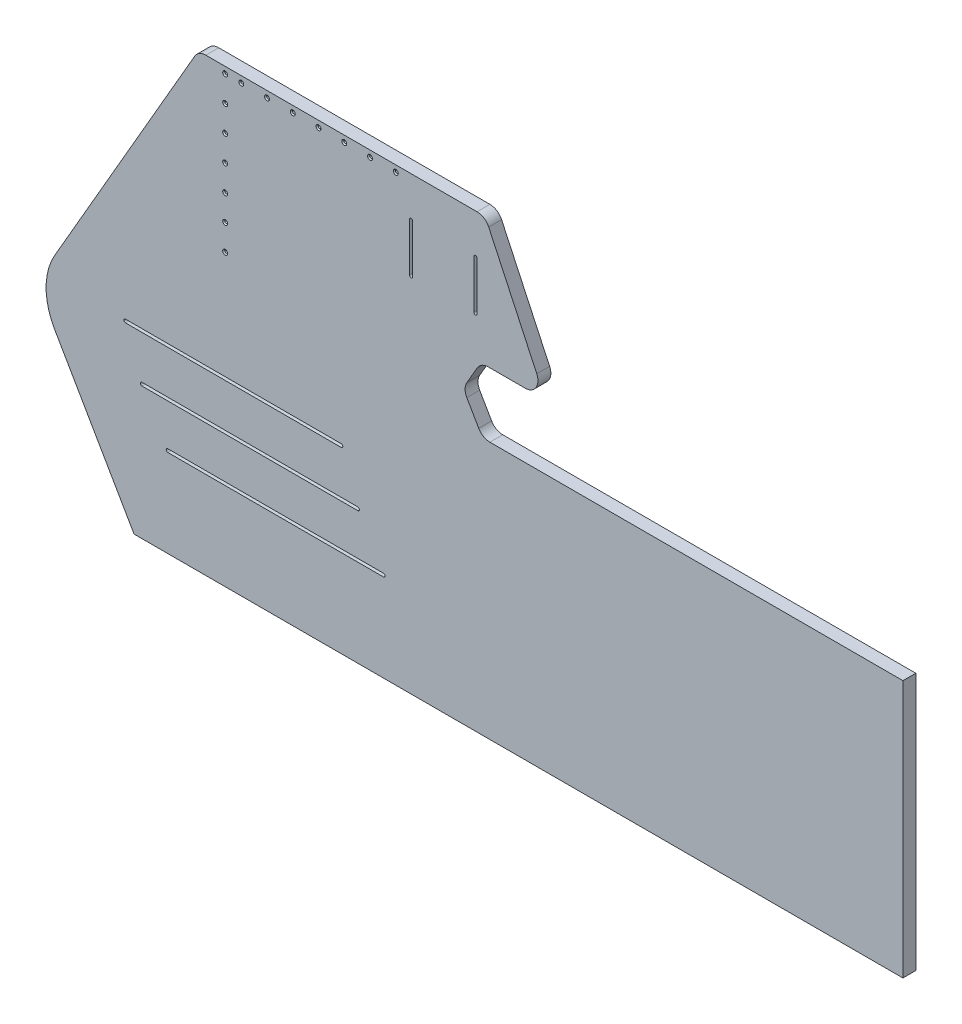
from build123d import *

# Parameters (mm, degrees)
BOSS_EXTRUDE1_DEPTH                                = 25.4
FILLET1_R                                          = 127
FILLET2_R                                          = 25.4
WHEEL_SLOT_DEPTH                                   = 25.4
PEDAL_SLOT_DEPTH                                   = 25.4
BOSS_EXTRUDE2_DEPTH                                = 25.4
FILLET3_R                                          = 25.4
CSK_FOR_10_FLAT_HEAD_MACHINE_SCREW_100_D           = 5.1054
CSK_FOR_10_FLAT_HEAD_MACHINE_SCREW_100_CSINK_D     = 9.779
CSK_FOR_10_FLAT_HEAD_MACHINE_SCREW_100_CSINK_ANGLE = 100


# Read off the part's stored shape, not the designer's step: wheel slot, pedal slot
with BuildPart() as part:
    # Sketch1 → Boss-Extrude1 (new body)
    with BuildSketch(Plane.XY):
        Polygon((0, 0), (-193.132194655, 334.514773719), (-19.646968374, 635), (107.353031626, 635), (-11.089113546, 889), (-576.905448196, 889), (-897.037642851, 334.514773719), (-703.905448196, 0), align=None)
    extrude(amount=BOSS_EXTRUDE1_DEPTH)

    # Fillet1
    fillet1_edges = [part.edges().sort_by_distance(p)[0] for p in [
        (-897.037642851, 334.514773719, 12.7),
        (-193.132194655, 334.514773719, 12.7),
    ]]
    fillet(fillet1_edges, radius=FILLET1_R)

    # Fillet2
    fillet2_edges = [part.edges().sort_by_distance(p)[0] for p in [
        (-576.905448196, 889, 12.7),
        (-11.089113546, 889, 12.7),
        (107.353031626, 635, 12.7),
        (-19.646968374, 635, 12.7),
    ]]
    fillet(fillet2_edges, radius=FILLET2_R)

    # wheel slot outline → wheel slot (cut)
    with BuildSketch(Plane.XY):
        with BuildLine():
            Line((-154.207271537, 714.375), (-154.207271537, 809.625))
            ThreePointArc((-154.207271537, 809.625), (-157.382271537, 812.8), (-160.557271537, 809.625))
            Line((-160.557271537, 809.625), (-160.557271537, 714.375))
            ThreePointArc((-160.557271537, 714.375), (-157.382271537, 711.2), (-154.207271537, 714.375))
        make_face()
        with BuildLine():
            Line((-27.207271537, 714.375), (-27.207271537, 809.625))
            ThreePointArc((-27.207271537, 809.625), (-30.382271537, 812.8), (-33.557271537, 809.625))
            Line((-33.557271537, 809.625), (-33.557271537, 714.375))
            ThreePointArc((-33.557271537, 714.375), (-30.382271537, 711.2), (-27.207271537, 714.375))
        make_face()
    extrude(amount=WHEEL_SLOT_DEPTH, mode=Mode.SUBTRACT)

    # pedal slot outline → pedal slot (cut)
    with BuildSketch(Plane.XY):
        with BuildLine():
            Line((-720.725, 352.425), (-295.275, 352.425))
            ThreePointArc((-295.275, 352.425), (-292.1, 355.6), (-295.275, 358.775))
            Line((-295.275, 358.775), (-720.725, 358.775))
            ThreePointArc((-720.725, 358.775), (-723.9, 355.6), (-720.725, 352.425))
        make_face()
        with BuildLine():
            Line((-688.030448196, 260.789543073), (-262.580448196, 260.789543073))
            ThreePointArc((-262.580448196, 260.789543073), (-259.405448196, 263.964543073), (-262.580448196, 267.139543073))
            Line((-262.580448196, 267.139543073), (-688.030448196, 267.139543073))
            ThreePointArc((-688.030448196, 267.139543073), (-691.205448196, 263.964543073), (-688.030448196, 260.789543073))
        make_face()
        with BuildLine():
            Line((-637.230448196, 172.801362049), (-211.780448196, 172.801362049))
            ThreePointArc((-211.780448196, 172.801362049), (-208.605448196, 175.976362049), (-211.780448196, 179.151362049))
            Line((-211.780448196, 179.151362049), (-637.230448196, 179.151362049))
            ThreePointArc((-637.230448196, 179.151362049), (-640.405448196, 175.976362049), (-637.230448196, 172.801362049))
        make_face()
    extrude(amount=PEDAL_SLOT_DEPTH, mode=Mode.SUBTRACT)

    # Sketch6 → Boss-Extrude2 (add)
    with BuildSketch(Plane.XY.offset(25.4)):
        with BuildLine():
            Line((0, 0), (812.8, 0))
            Line((812.8, 0), (812.8, 508))
            Line((812.8, 508), (-16.622799945, 508))
            Line((-16.622799945, 508), (-54.796626253, 574.119006685))
            Line((-54.796626253, 574.119006685), (-156.470452561, 398.014773719))
            ThreePointArc((-156.470452561, 398.014773719), (-173.485226281, 334.514773719), (-156.470452561, 271.014773719))
            Line((-156.470452561, 271.014773719), (0, 0))
        make_face()
    extrude(amount=-BOSS_EXTRUDE2_DEPTH)

    # Fillet3
    fillet3_edges = [part.edges().sort_by_distance(p)[0] for p in [
        (-54.796626253, 574.119006685, 12.7),
        (-16.622799945, 508, 12.7),
    ]]
    fillet(fillet3_edges, radius=FILLET3_R)

    # CSK for #10 Flat Head Machine Screw (100)1 (through all)
    with Locations(Plane.XY.offset(25.4)):
        with Locations((-524.140751359, 876.3), (-524.140751359, 825.5), (-492.390751359, 876.3), (-441.590751359, 876.3), (-390.790751359, 876.3), (-339.990751359, 876.3), (-289.190751359, 876.3), (-238.390751359, 876.3), (-524.140751359, 774.7), (-524.140751359, 723.9), (-524.140751359, 673.1), (-524.140751359, 622.3), (-524.140751359, 571.5), (-187.590751359, 876.3)):
            CounterSinkHole(CSK_FOR_10_FLAT_HEAD_MACHINE_SCREW_100_D / 2, CSK_FOR_10_FLAT_HEAD_MACHINE_SCREW_100_CSINK_D / 2, counter_sink_angle=CSK_FOR_10_FLAT_HEAD_MACHINE_SCREW_100_CSINK_ANGLE)


solid = part.part
